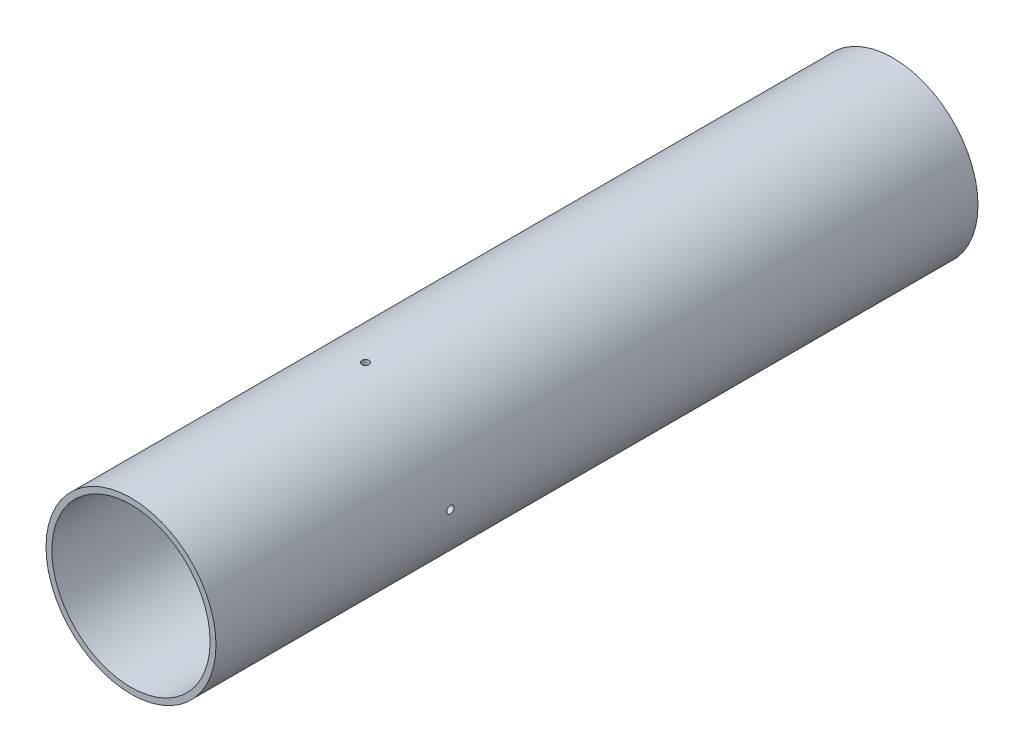
from build123d import *

# Parameters (mm, degrees)
SKETCH1_R           = 29
SKETCH1_R_2         = 27
BOSS_EXTRUDE1_DEPTH = 260
SKETCH3_R           = 1.25
CUT_EXTRUDE1_DEPTH  = 10
CIRPATTERN1_COUNT   = 4


with BuildPart() as part:
    # Sketch1 → Boss-Extrude1 (new body)
    with BuildSketch(Plane.XY):
        Circle(SKETCH1_R)
        Circle(SKETCH1_R_2, mode=Mode.SUBTRACT)
    extrude(amount=BOSS_EXTRUDE1_DEPTH)

    # Sketch3 → Cut-Extrude1 (cut)
    with BuildSketch(Plane(origin=(29, 0, 0), x_dir=(0, 0, -1), z_dir=(1, 0, 0))):
        with Locations((-180, 0)):
            Circle(SKETCH3_R)
    cut_extrude1 = extrude(amount=-CUT_EXTRUDE1_DEPTH, mode=Mode.SUBTRACT)

    # CirPattern1: Cut-Extrude1 ×4 about axis
    cirpattern1_axis = Axis((0, 0, 260), (0, 0, -1))
    for i in range(1, CIRPATTERN1_COUNT):
        add(cut_extrude1.rotate(cirpattern1_axis, i * 360 / CIRPATTERN1_COUNT), mode=Mode.SUBTRACT)


solid = part.part
